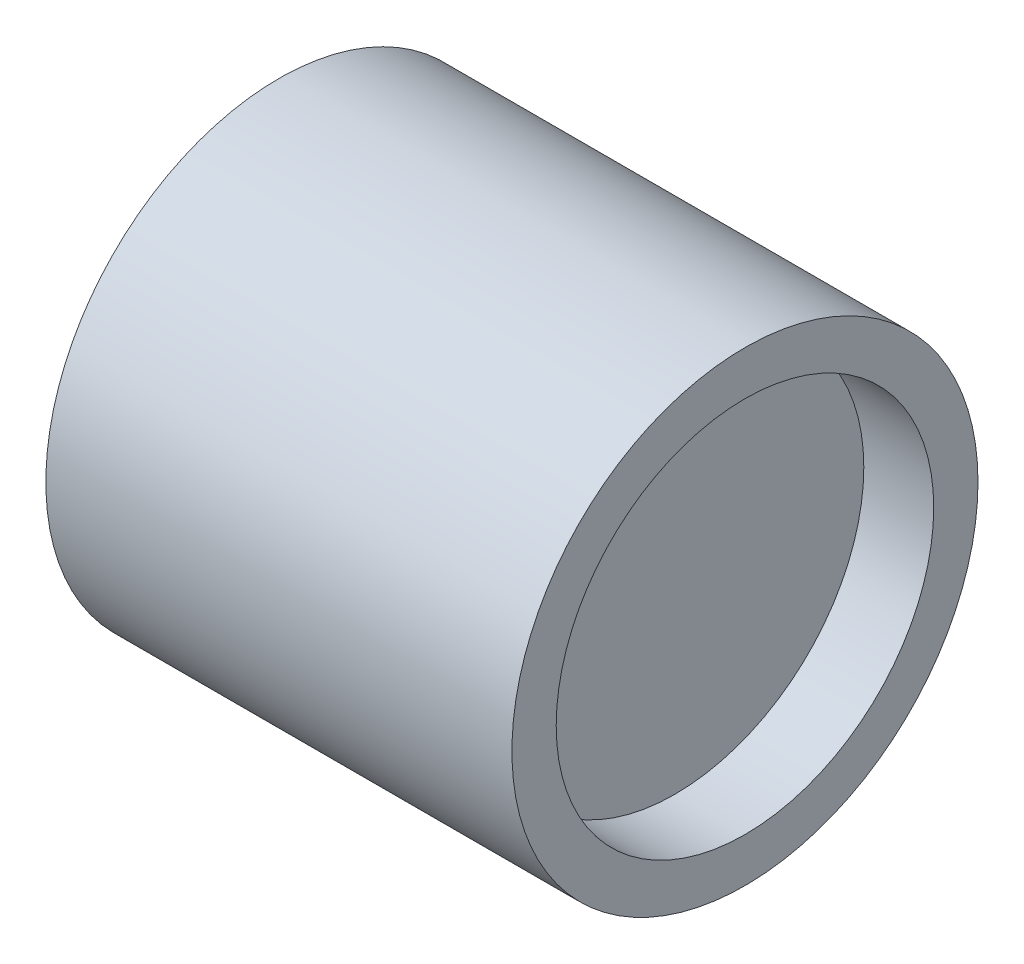
from build123d import *

# Parameters (mm, degrees)
SKETCH1_R           = 5
BOSS_EXTRUDE1_DEPTH = 10
SKETCH2_R           = 4.05
CUT_EXTRUDE1_DEPTH  = 1.5
SKETCH4_R           = 2.525
CUT_EXTRUDE2_DEPTH  = 6


with BuildPart() as part:
    # Sketch1 → Boss-Extrude1 (new body)
    with BuildSketch(Plane.YZ):
        Circle(SKETCH1_R)
    extrude(amount=BOSS_EXTRUDE1_DEPTH)

    # Sketch2 → Cut-Extrude1 (cut)
    with BuildSketch(Plane.YZ.offset(10)):
        Circle(SKETCH2_R)
    extrude(amount=-CUT_EXTRUDE1_DEPTH, mode=Mode.SUBTRACT)

    # Sketch4 → Cut-Extrude2 (cut)
    with BuildSketch(Plane(origin=(0, 0, 0), x_dir=(0, -1, 0), z_dir=(-1, 0, 0))):
        Circle(SKETCH4_R)
    extrude(amount=-CUT_EXTRUDE2_DEPTH, mode=Mode.SUBTRACT)


solid = part.part
